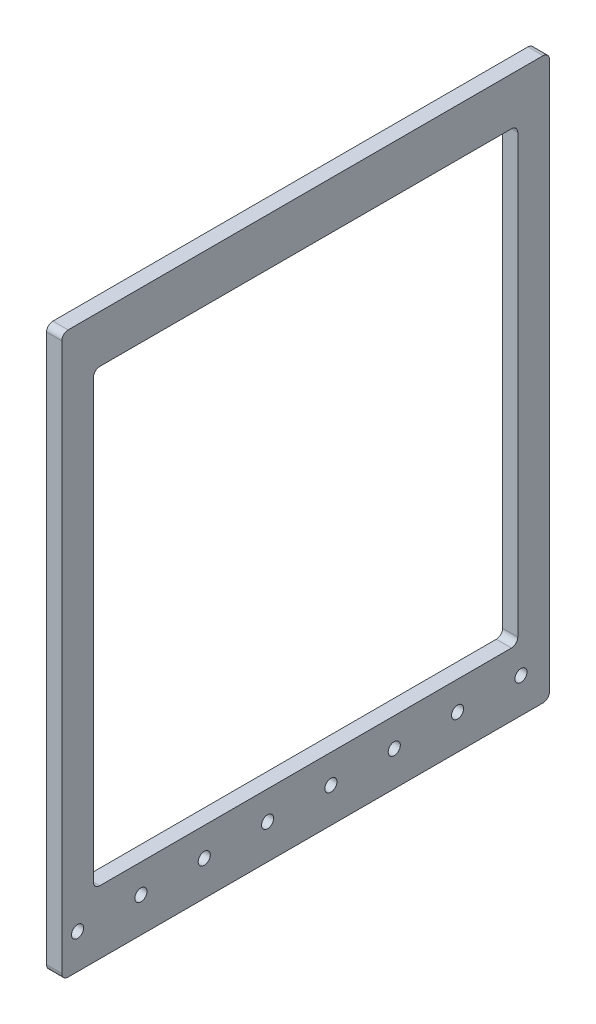
from build123d import *

# Parameters (mm, degrees)
SKETCH1_W           = 195.58
SKETCH1_H           = 224.79
SKETCH1_R           = 2.425
SKETCH1_W_2         = 170.18
SKETCH1_H_2         = 180.34
BOSS_EXTRUDE1_DEPTH = 6.096
FILLET1_R           = 2.54


with BuildPart() as part:
    # Sketch1 → Boss-Extrude1 (new body)
    with BuildSketch(Plane(origin=(0, 0, 0), x_dir=(0, 0, -1), z_dir=(1, 0, 0))):
        with Locations((85.09, -93.345)):
            Rectangle(SKETCH1_W, SKETCH1_H)
        with Locations((-6.35, -191.77)):
            Circle(SKETCH1_R, mode=Mode.SUBTRACT)
        with Locations((19.05, -191.77)):
            Circle(SKETCH1_R, mode=Mode.SUBTRACT)
        with Locations((44.45, -191.77)):
            Circle(SKETCH1_R, mode=Mode.SUBTRACT)
        with Locations((69.85, -191.77)):
            Circle(SKETCH1_R, mode=Mode.SUBTRACT)
        with Locations((95.25, -191.77)):
            Circle(SKETCH1_R, mode=Mode.SUBTRACT)
        with Locations((120.65, -191.77)):
            Circle(SKETCH1_R, mode=Mode.SUBTRACT)
        with Locations((146.05, -191.77)):
            Circle(SKETCH1_R, mode=Mode.SUBTRACT)
        with Locations((171.45, -191.77)):
            Circle(SKETCH1_R, mode=Mode.SUBTRACT)
        with Locations((85.09, -90.17)):
            Rectangle(SKETCH1_W_2, SKETCH1_H_2, mode=Mode.SUBTRACT)
    extrude(amount=BOSS_EXTRUDE1_DEPTH)

    # Fillet1
    fillet1_edges = [part.edges().sort_by_distance(p)[0] for p in [
        (3.048, 19.05, -182.88),
        (3.048, 19.05, 12.7),
        (3.048, -205.74, -182.88),
        (3.048, -205.74, 12.7),
        (3.048, -180.34, 0),
        (3.048, -180.34, -170.18),
        (3.048, 0, -170.18),
        (3.048, 0, 0),
    ]]
    fillet(fillet1_edges, radius=FILLET1_R)


solid = part.part
